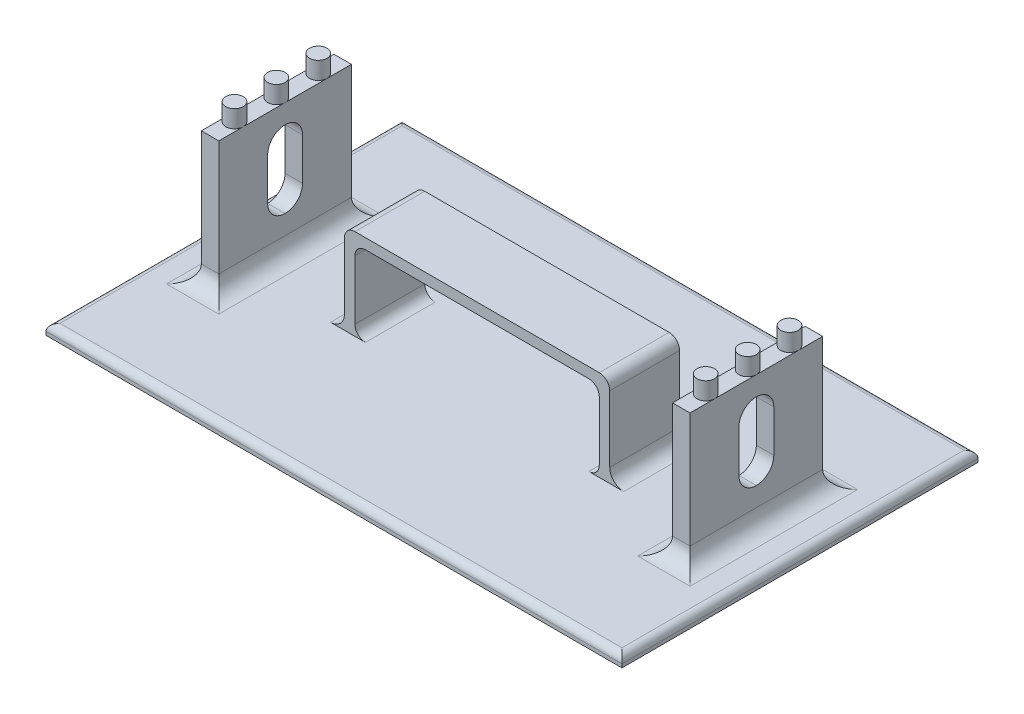
from build123d import *

# Parameters (mm, degrees)
SKETCH1_W            = 165
SKETCH1_H            = 90
BOSS_EXTRUDE1_DEPTH  = 3
SKETCH2_W            = 5
SKETCH2_H            = 38
BOSS_EXTRUDE3_DEPTH  = 38
FILLET1_R            = 5
SKETCH3_R            = 2.5
BOSS_EXTRUDE4_DEPTH  = 5
SKETCH4_W            = 3
SKETCH4_H            = 20
BOSS_EXTRUDE5_DEPTH  = 23
SKETCH5_W            = 76
SKETCH5_H            = 20
BOSS_EXTRUDE6_DEPTH  = 3
FILLET3_R            = 3
FILLET4_R            = 3
SKETCH8_W            = 10
SKETCH8_H            = 22
CUT_EXTRUDE1_DEPTH   = 10
FILLET10_R           = 5
SKETCH9_W            = 10
SKETCH9_H            = 22
CUT_EXTRUDE2_DEPTH   = 10
FILLET11_R           = 5
SKETCH10_W           = 165
SKETCH10_H           = 6
BOSS_EXTRUDE9_DEPTH  = 3
FILLET13_R           = 4
SKETCH11_R           = 2.5
BOSS_EXTRUDE10_DEPTH = 5
FILLET14_R           = 2


with BuildPart() as part:
    # Sketch1 → Boss-Extrude1 (new body)
    with BuildSketch(Plane(origin=(0, 0, 0), x_dir=(1, 0, 0), z_dir=(0, 1, 0))):
        with Locations((82.5, 45)):
            Rectangle(SKETCH1_W, SKETCH1_H)
    extrude(amount=BOSS_EXTRUDE1_DEPTH)

    # Sketch2 → Boss-Extrude3 (add)
    with BuildSketch(Plane(origin=(0, 3, 0), x_dir=(1, 0, 0), z_dir=(0, 1, 0))):
        with Locations((15, 45)):
            Rectangle(SKETCH2_W, SKETCH2_H)
        with Locations((150, 45)):
            Rectangle(SKETCH2_W, SKETCH2_H)
    extrude(amount=BOSS_EXTRUDE3_DEPTH)

    # Fillet1
    fillet1_edges = [part.edges().sort_by_distance(p)[0] for p in [
        (12.5, 3, -45),
        (15, 3, -26),
        (17.5, 3, -45),
        (15, 3, -64),
        (150, 3, -64),
        (147.5, 3, -45),
        (150, 3, -26),
        (152.5, 3, -45),
    ]]
    fillet(fillet1_edges, radius=FILLET1_R)

    # Sketch3 → Boss-Extrude4 (add)
    with BuildSketch(Plane(origin=(0, 41, 0), x_dir=(1, 0, 0), z_dir=(0, 1, 0))):
        with Locations(Location((15, 57, 0), (0, 0, 180))):
            Circle(SKETCH3_R)
        with Locations(Location((15, 33, 0), (0, 0, 180))):
            Circle(SKETCH3_R)
        with Locations(Location((150, 57, 0), (0, 0, 180))):
            Circle(SKETCH3_R)
        with Locations(Location((150, 33, 0), (0, 0, 180))):
            Circle(SKETCH3_R)
    extrude(amount=BOSS_EXTRUDE4_DEPTH)

    # Sketch4 → Boss-Extrude5 (add)
    with BuildSketch(Plane(origin=(0, 3, 0), x_dir=(1, 0, 0), z_dir=(0, 1, 0))):
        with Locations((119, 45)):
            Rectangle(SKETCH4_W, SKETCH4_H)
        with Locations((46, 45)):
            Rectangle(SKETCH4_W, SKETCH4_H)
    extrude(amount=BOSS_EXTRUDE5_DEPTH)

    # Sketch5 → Boss-Extrude6 (add)
    with BuildSketch(Plane(origin=(0, 26, 0), x_dir=(1, 0, 0), z_dir=(0, 1, 0))):
        with Locations((82.5, 45)):
            Rectangle(SKETCH5_W, SKETCH5_H)
    extrude(amount=BOSS_EXTRUDE6_DEPTH)

    # Fillet3
    fillet3_edges = [part.edges().sort_by_distance(p)[0] for p in [
        (47.5, 3, -45),
        (47.5, 26, -45),
        (117.5, 3, -45),
        (117.5, 26, -45),
    ]]
    fillet(fillet3_edges, radius=FILLET3_R)

    # Fillet4
    fillet4_edges = [part.edges().sort_by_distance(p)[0] for p in [
        (120.5, 29, -45),
        (44.5, 29, -45),
    ]]
    fillet(fillet4_edges, radius=FILLET4_R)

    # Sketch8 → Cut-Extrude1 (cut)
    with BuildSketch(Plane.ZY.offset(-12.5)):
        with Locations((-45, 24.5)):
            Rectangle(SKETCH8_W, SKETCH8_H)
    extrude(amount=-CUT_EXTRUDE1_DEPTH, mode=Mode.SUBTRACT)

    # Fillet10
    fillet10_edges = [part.edges().sort_by_distance(p)[0] for p in [
        (15, 13.5, -50),
        (15, 35.5, -50),
        (15, 13.5, -40),
        (15, 35.5, -40),
    ]]
    fillet(fillet10_edges, radius=FILLET10_R - 0.0001)  # a hair under: the kernel refuses the full size

    # Sketch9 → Cut-Extrude2 (cut)
    with BuildSketch(Plane(origin=(152.5, 0, 0), x_dir=(0, 0, -1), z_dir=(1, 0, 0))):
        with Locations((45, 24.5)):
            Rectangle(SKETCH9_W, SKETCH9_H)
    extrude(amount=-CUT_EXTRUDE2_DEPTH, mode=Mode.SUBTRACT)

    # Fillet11
    fillet11_edges = [part.edges().sort_by_distance(p)[0] for p in [
        (150, 35.5, -40),
        (150, 13.5, -40),
        (150, 13.5, -50),
        (150, 35.5, -50),
    ]]
    fillet(fillet11_edges, radius=FILLET11_R - 0.0001)  # a hair under: the kernel refuses the full size

    # Sketch10 → Boss-Extrude9 (add)
    with BuildSketch(Plane.XZ):
        with Locations((82.5, -93)):
            Rectangle(SKETCH10_W, SKETCH10_H)
        with Locations((82.5, 3)):
            Rectangle(SKETCH10_W, SKETCH10_H)
    extrude(amount=-BOSS_EXTRUDE9_DEPTH)

    # Fillet13
    fillet13_edges = [part.edges().sort_by_distance(p)[0] for p in [
        (44.5, 3, -45),
        (120.5, 3, -45),
    ]]
    fillet(fillet13_edges, radius=FILLET13_R)

    # Sketch11 → Boss-Extrude10 (add)
    with BuildSketch(Plane(origin=(0, 41, 0), x_dir=(1, 0, 0), z_dir=(0, 1, 0))):
        with Locations(Location((150, 45, 0), (0, 0, 180))):
            Circle(SKETCH11_R)
        with Locations(Location((15, 45, 0), (0, 0, 180))):
            Circle(SKETCH11_R)
    extrude(amount=BOSS_EXTRUDE10_DEPTH)

    # Fillet14
    fillet14_edges = [part.edges().sort_by_distance(p)[0] for p in [
        (165, 3, -45),
        (82.5, 3, -96),
        (82.5, 3, 6),
        (0, 3, -45),
    ]]
    fillet(fillet14_edges, radius=FILLET14_R)


solid = part.part
